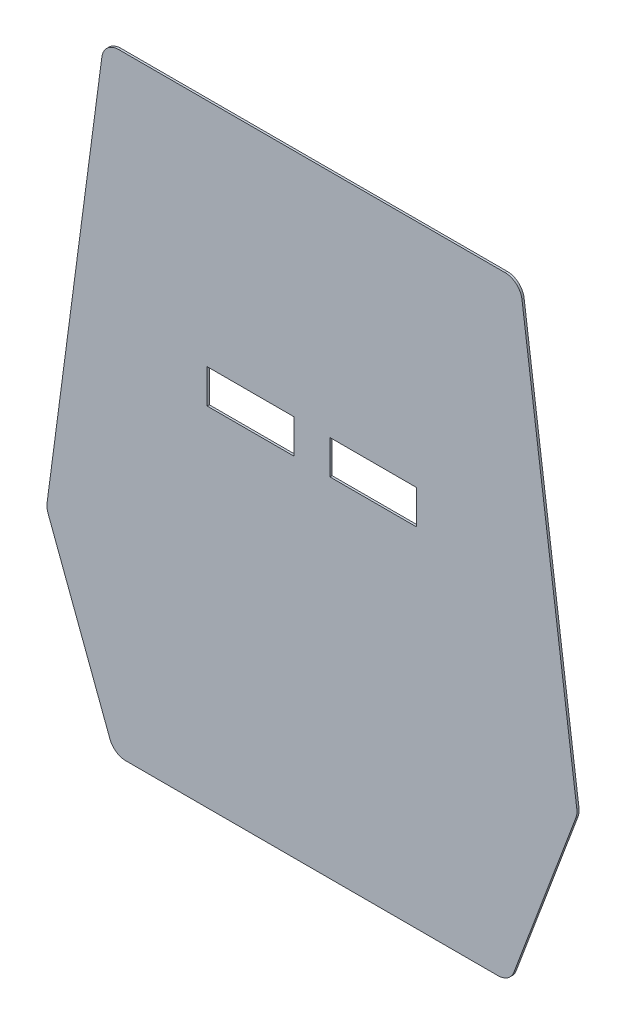
from build123d import *

# Parameters (mm, degrees)
BASE_FLANGE1_DEPTH  = 3.175
FILLET1_R           = 25
SKETCH2_W           = 127
SKETCH2_H           = 50
CUT_EXTRUDE1_DEPTH  = 10
SKETCH3_W           = 100
SKETCH3_H           = 100
BOSS_EXTRUDE1_DEPTH = 2
SKETCH4_W           = 90
SKETCH4_H           = 90
BOSS_EXTRUDE2_DEPTH = 40
FILLET3_R           = 20


# Sheet-metal steps are written as plain solids
with BuildPart() as part:
    # Sketch1 → Base-Flange1 (new body)
    with BuildSketch(Plane.XY):
        Polygon((-305.02, 897.72), (-389.09, 263.21), (-290.03, 0), (290.03, 0), (389.09, 263.21), (305.02, 897.72), align=None)
    extrude(amount=-BASE_FLANGE1_DEPTH)

    # Fillet1
    fillet1_edges = [part.edges().sort_by_distance(p)[0] for p in [
        (-290.03, 0, -1.5875),
        (-389.09, 263.21, -1.5875),
        (-305.02, 897.72, -1.5875),
        (305.02, 897.72, -1.5875),
        (389.09, 263.21, -1.5875),
        (290.03, 0, -1.5875),
    ]]
    fillet(fillet1_edges, radius=FILLET1_R)

    # Sketch2 → Cut-Extrude1 (cut)
    with BuildSketch(Plane.XY):
        with Locations((-90, 535)):
            Rectangle(SKETCH2_W, SKETCH2_H)
        with Locations((90, 535)):
            Rectangle(SKETCH2_W, SKETCH2_H)
    extrude(amount=-CUT_EXTRUDE1_DEPTH, mode=Mode.SUBTRACT)

    # Sketch3 → Boss-Extrude1 (add)
    with BuildSketch(Plane(origin=(0, 0, -3.175), x_dir=(-1, 0, 0), z_dir=(0, 0, -1))):
        with Locations((0, 685)):
            Rectangle(SKETCH3_W, SKETCH3_H)
    extrude(amount=BOSS_EXTRUDE1_DEPTH)

    # Sketch4 → Boss-Extrude2 (add)
    with BuildSketch(Plane(origin=(0, 0, -5.175), x_dir=(-1, 0, 0), z_dir=(0, 0, -1))):
        with Locations((0, 685)):
            Rectangle(SKETCH4_W, SKETCH4_H)
    extrude(amount=BOSS_EXTRUDE2_DEPTH)

    # Fillet3
    fillet3_edges = [part.edges().sort_by_distance(p)[0] for p in [
        (-45, 685, -45.175),
        (0, 730, -45.175),
        (45, 685, -45.175),
        (0, 640, -45.175),
    ]]
    fillet(fillet3_edges, radius=FILLET3_R)


solid = part.part
